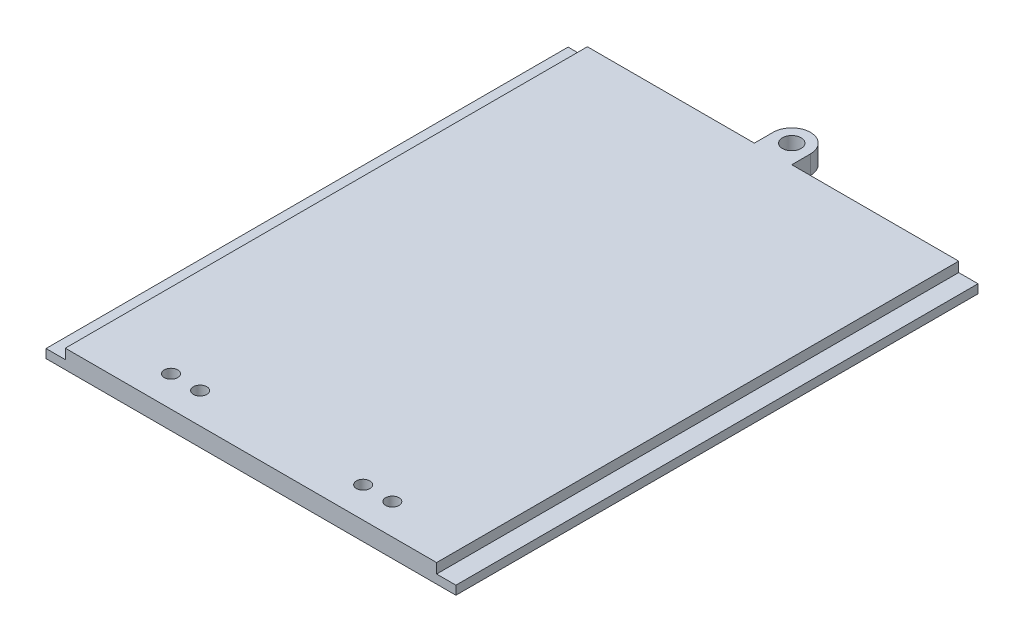
from build123d import *

# Parameters (mm, degrees)
SKETCH1_W           = 139.192
SKETCH1_H           = 177.292
BOSS_EXTRUDE1_DEPTH = 6.35
SKETCH2_W           = 6.55
SKETCH2_H           = 177.292
CUT_EXTRUDE1_DEPTH  = 3.375
SKETCH3_W           = 12.7
SKETCH3_H           = 12.7
BOSS_EXTRUDE2_DEPTH = 6.35
FILLET1_R           = 6.35
SKETCH4_R           = 3.175
CUT_EXTRUDE2_DEPTH  = 236.609200644
SKETCH5_R           = 2.286
CUT_EXTRUDE3_DEPTH  = 12.7


with BuildPart() as part:
    # Sketch1 → Boss-Extrude1 (new body)
    with BuildSketch(Plane(origin=(0, 0, 0), x_dir=(1, 0, 0), z_dir=(0, 1, 0))):
        with Locations((69.596, 88.646)):
            Rectangle(SKETCH1_W, SKETCH1_H)
    extrude(amount=BOSS_EXTRUDE1_DEPTH)

    # Sketch2 → Cut-Extrude1 (cut)
    with BuildSketch(Plane(origin=(0, 6.35, 0), x_dir=(1, 0, 0), z_dir=(0, 1, 0))):
        with Locations((135.917, 88.646)):
            Rectangle(SKETCH2_W, SKETCH2_H)
        with Locations((3.275, 88.646)):
            Rectangle(SKETCH2_W, SKETCH2_H)
    extrude(amount=-CUT_EXTRUDE1_DEPTH, mode=Mode.SUBTRACT)

    # Sketch3 → Boss-Extrude2 (add)
    with BuildSketch(Plane(origin=(0, 6.35, 0), x_dir=(1, 0, 0), z_dir=(0, 1, 0))):
        with Locations((69.596, 183.642)):
            Rectangle(SKETCH3_W, SKETCH3_H)
    extrude(amount=-BOSS_EXTRUDE2_DEPTH)

    # Fillet1
    fillet1_edges = [part.edges().sort_by_distance(p)[0] for p in [
        (63.246, 3.175, -189.992),
        (75.946, 3.175, -189.992),
    ]]
    fillet(fillet1_edges, radius=FILLET1_R - 0.0001)  # a hair under: the kernel refuses the full size

    # Sketch4 → Cut-Extrude2 (cut, through all)
    with BuildSketch(Plane(origin=(0, 6.35, 0), x_dir=(1, 0, 0), z_dir=(0, 1, 0))):
        with Locations(Location((69.596, 183.642, 0), (0, 0, 270))):
            Circle(SKETCH4_R)
    extrude(amount=-CUT_EXTRUDE2_DEPTH, mode=Mode.SUBTRACT)

    # Sketch5 → Cut-Extrude3 (cut)
    with BuildSketch(Plane.XZ):
        with Locations(Location((107.188, -10.414, 0), (0, 0, 270))):
            Circle(SKETCH5_R)
        with Locations(Location((97.282, -10.414, 0), (0, 0, 270))):
            Circle(SKETCH5_R)
        with Locations(Location((41.91, -10.414, 0), (0, 0, 270))):
            Circle(SKETCH5_R)
        with Locations(Location((32.004, -10.414, 0), (0, 0, 270))):
            Circle(SKETCH5_R)
    extrude(amount=-CUT_EXTRUDE3_DEPTH, mode=Mode.SUBTRACT)


solid = part.part
